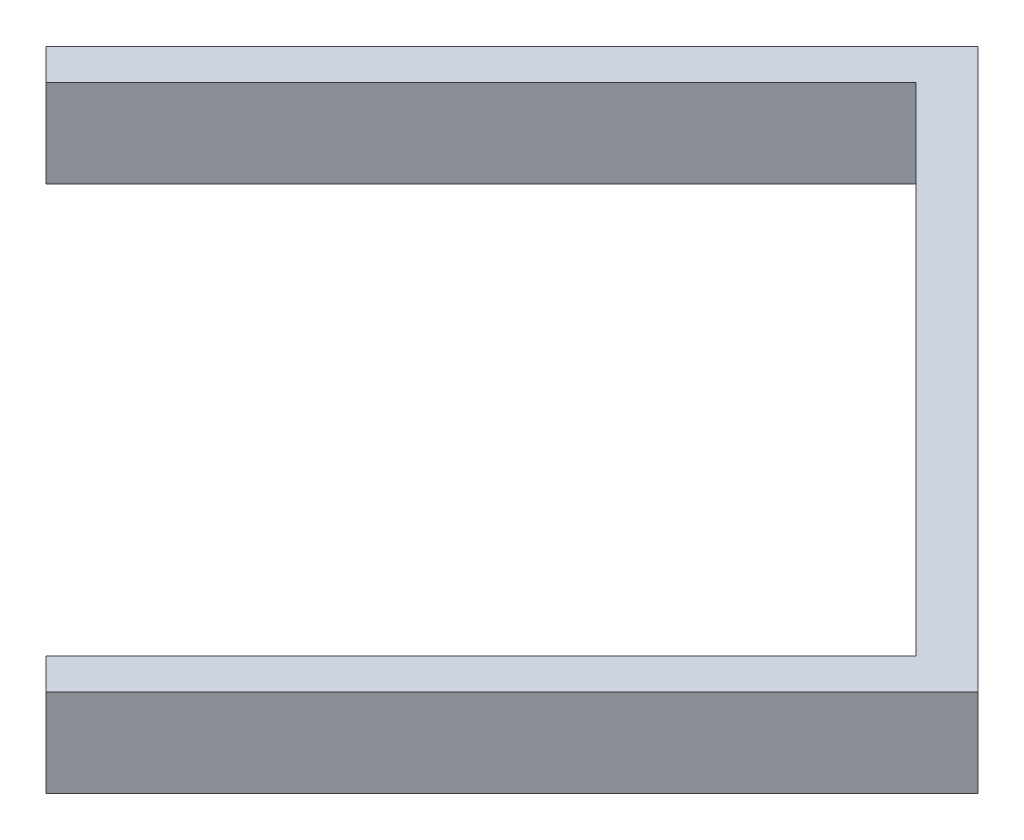
from build123d import *

# Parameters (mm, degrees)
BOSS_EXTRUDE2_DEPTH = 50.8
SKETCH3_R           = 6.35
CUT_EXTRUDE1_DEPTH  = 50.8


with BuildPart() as part:
    # Sketch2 → Boss-Extrude2 (new body)
    with BuildSketch(Plane(origin=(0, 0, 0), x_dir=(1, 0, 0), z_dir=(0, 1, 0))):
        Polygon((-329.945841036, 65.766337151), (-311.985328794, 47.805824909), (-60.538157404, 299.252996299), (83.145940533, 155.568898362), (226.83003847, 11.884800425), (-24.61713292, -239.562370965), (-6.656620678, -257.522883207), (262.751062954, 11.884800425), (-60.538157404, 335.174020783), align=None)
    extrude(amount=BOSS_EXTRUDE2_DEPTH)

    # Sketch3 → Cut-Extrude1 (cut)
    with BuildSketch(Plane(origin=(137.31793169, 0, -137.31793169), x_dir=(-0.7071067811865475, 0, -0.7071067811865477), z_dir=(0.7071067811865477, 0, -0.7071067811865475))):
        with Locations((0, 25.4)):
            Circle(SKETCH3_R)
    extrude(amount=-CUT_EXTRUDE1_DEPTH, mode=Mode.SUBTRACT)


solid = part.part
